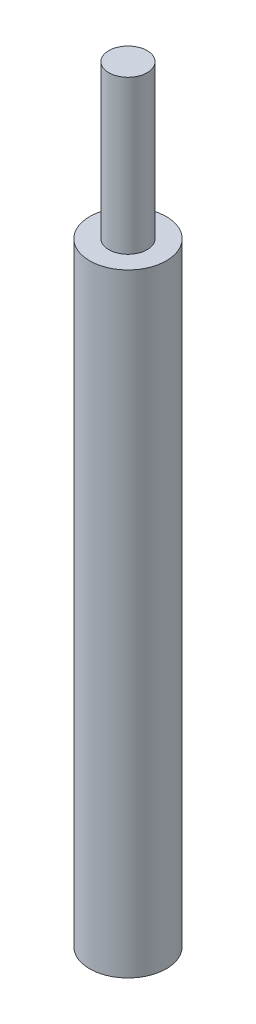
from build123d import *

# Parameters (mm, degrees)
SKETCH1_R                        = 3.175
BOSS_EXTRUDE1_DEPTH              = 50.8
SKETCH2_R                        = 1.5875
BOSS_EXTRUDE2_DEPTH              = 12.7
F_1_8_0_125_DIAMETER_HOLE1_D     = 3.175
F_1_8_0_125_DIAMETER_HOLE1_DEPTH = 12.7
F_1_8_0_125_DIAMETER_HOLE1_TIP   = 0.953866233


with BuildPart() as part:
    # Sketch1 → Boss-Extrude1 (new body)
    with BuildSketch(Plane(origin=(0, 0, 0), x_dir=(1, 0, 0), z_dir=(0, 1, 0))):
        Circle(SKETCH1_R)
    extrude(amount=BOSS_EXTRUDE1_DEPTH)

    # Sketch2 → Boss-Extrude2 (add)
    with BuildSketch(Plane(origin=(0, 50.8, 0), x_dir=(1, 0, 0), z_dir=(0, 1, 0))):
        Circle(SKETCH2_R)
    extrude(amount=BOSS_EXTRUDE2_DEPTH)

    # 1/8 (0.125) Diameter Hole1
    with Locations(Plane.XZ):
        with Locations((0, 0)):
            Hole(F_1_8_0_125_DIAMETER_HOLE1_D / 2, depth=F_1_8_0_125_DIAMETER_HOLE1_DEPTH)
            with Locations((0, 0, -(F_1_8_0_125_DIAMETER_HOLE1_DEPTH + F_1_8_0_125_DIAMETER_HOLE1_TIP / 2))):  # 118° drill point
                Cone(0, F_1_8_0_125_DIAMETER_HOLE1_D / 2, F_1_8_0_125_DIAMETER_HOLE1_TIP, mode=Mode.SUBTRACT)


solid = part.part
